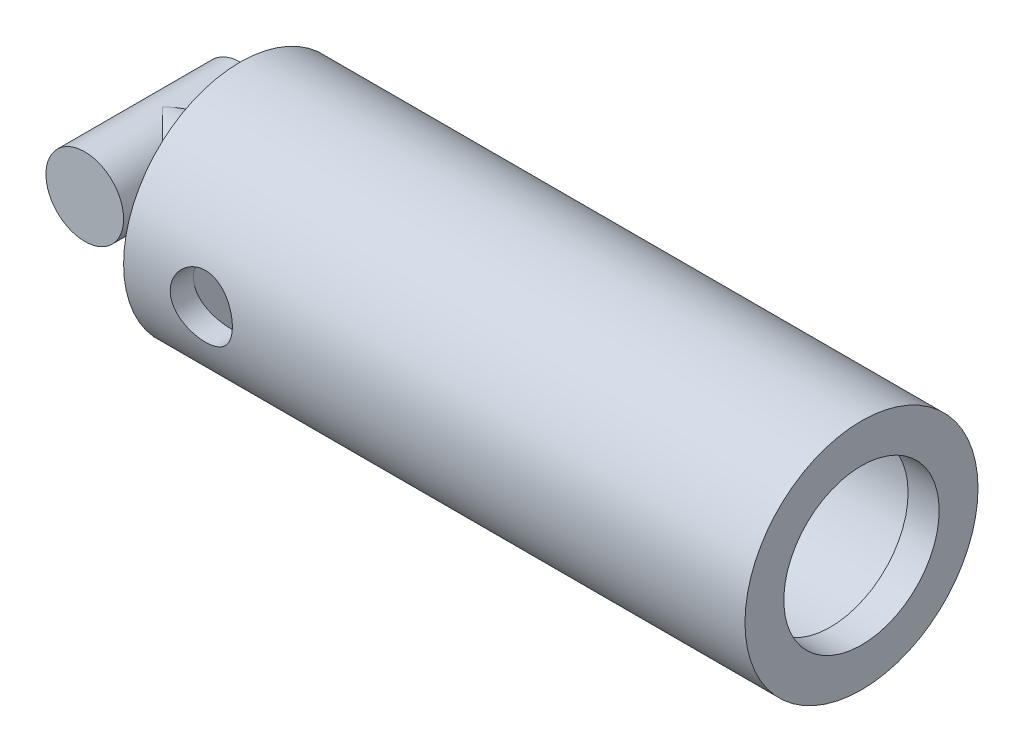
from build123d import *

# Parameters (mm, degrees)
SKETCH1_R                = 7.5
BOSS_EXTRUDE1_DEPTH      = 40
SKETCH2_R                = 5
CUT_EXTRUDE1_DEPTH       = 2
SKETCH3_R                = 6
CUT_EXTRUDE2_DEPTH       = 35
SKETCH4_R                = 2.5
BOSS_EXTRUDE4_DEPTH      = 5
BOSS_EXTRUDE5_DEPTH      = 5
BOSS_EXTRUDE5_DEPTH_BACK = 5
SKETCH6_R                = 2.5
F_3DSKETCH3_R            = 2
CUT_EXTRUDE3_DEPTH       = 39.810436741


with BuildPart() as part:
    # Sketch1 → Boss-Extrude1 (new body)
    with BuildSketch(Plane(origin=(0, 0, 0), x_dir=(0, 0, -1), z_dir=(1, 0, 0))):
        Circle(SKETCH1_R)
    extrude(amount=BOSS_EXTRUDE1_DEPTH)

    # Sketch2 → Cut-Extrude1 (cut)
    with BuildSketch(Plane(origin=(40, 0, 0), x_dir=(0, 0, -1), z_dir=(1, 0, 0))):
        Circle(SKETCH2_R)
    extrude(amount=-CUT_EXTRUDE1_DEPTH, mode=Mode.SUBTRACT)

    # Sketch3 → Cut-Extrude2 (cut)
    with BuildSketch(Plane(origin=(38, 0, 0), x_dir=(0, 0, -1), z_dir=(1, 0, 0))):
        Circle(SKETCH3_R)
    extrude(amount=-CUT_EXTRUDE2_DEPTH, mode=Mode.SUBTRACT)

    # Sketch4 → Boss-Extrude4 (add)
    with BuildSketch(Plane.ZY):
        Circle(SKETCH4_R)
    extrude(amount=BOSS_EXTRUDE4_DEPTH)

    # Sketch6 → Boss-Extrude5 (add, two sides: drawn at the far end of the back side and taken through both)
    with BuildSketch(Plane.XY.offset(-BOSS_EXTRUDE5_DEPTH_BACK)):
        with Locations((-5, 0)):
            Circle(SKETCH6_R)
    extrude(amount=BOSS_EXTRUDE5_DEPTH + BOSS_EXTRUDE5_DEPTH_BACK)

    # 3DSketch3 → Cut-Extrude3 (cut, through all)
    with BuildSketch(Plane(origin=(5, 0, -7.5), x_dir=(0, 1, 0), z_dir=(0, 0, -1))):
        Circle(F_3DSKETCH3_R)
    extrude(amount=-CUT_EXTRUDE3_DEPTH, mode=Mode.SUBTRACT)


solid = part.part
